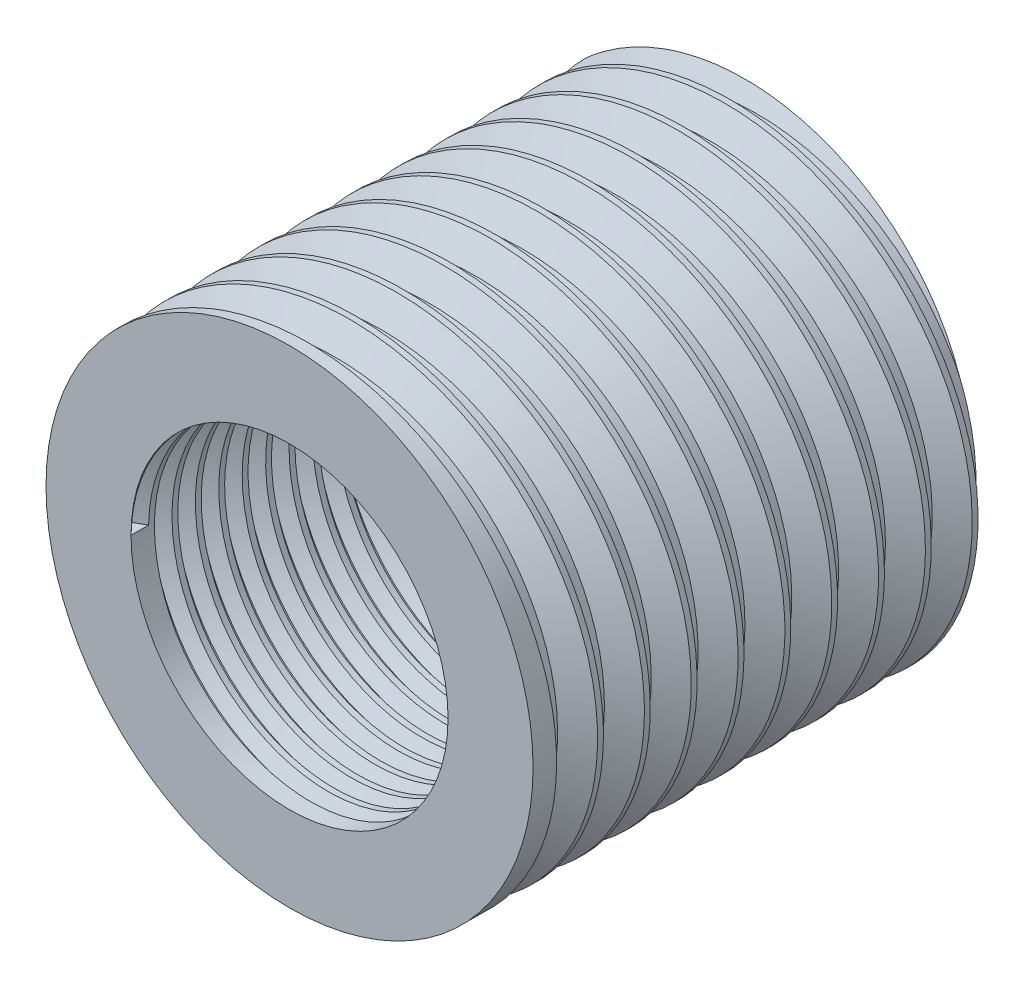
from build123d import *

# Parameters (mm, degrees)
SKETCH1_R           = 10.4
SKETCH1_R_2         = 6.769294136
BOSS_EXTRUDE1_DEPTH = 20
THREAD1_PITCH       = 1
THREAD2_PITCH       = 2


with BuildPart() as part:
    # Sketch1 → Boss-Extrude1 (new body)
    with BuildSketch(Plane.XY):
        Circle(SKETCH1_R)
        Circle(SKETCH1_R_2, mode=Mode.SUBTRACT)
    extrude(amount=BOSS_EXTRUDE1_DEPTH)

    # Thread1: the profile of Thread Profile1 profile screwed along a right-hand helix of 20 turns, 8 arcs to a turn; built about Z, then put on its axis
    thread1_z = Axis((0, 0, 0), (0, 0, 1))
    thread1_corners = [(6.768994136, 0, -0.000173205), (7.310560011, 0, 0.312499999), (7.310560011, 0, 0.437499999), (6.768994136, 0, 0.750173202)]
    with BuildLine(mode=Mode.PRIVATE) as thread1_profile:
        Line(thread1_corners[0], thread1_corners[1])
        Line(thread1_corners[1], thread1_corners[2])
        Line(thread1_corners[2], thread1_corners[3])
        Line(thread1_corners[3], thread1_corners[0])
    thread1_cap = Face(thread1_profile.wire())
    thread1_turn_angles = [0, 22.5, 45, 67.5, 90, 112.5, 135, 157.5, 180, 202.5, 225, 247.5, 270, 292.5, 315, 337.5, 360]
    thread1_turn_weights = [1, 0.9238795325112867, 1, 0.9238795325112867, 1, 0.9238795325112867, 1, 0.9238795325112867, 1, 0.9238795325112867, 1, 0.9238795325112867, 1, 0.9238795325112867, 1, 0.9238795325112867, 1]
    thread1_turn_rails = [Edge.make_bspline([Vector(p[0], p[1], 0).rotate(thread1_z, thread1_turn_angles[k]) / thread1_turn_weights[k] + Vector(0, 0, p[2] + THREAD1_PITCH * thread1_turn_angles[k] / 360) for k in range(17)], [0, 0, 0, 1, 1, 2, 2, 3, 3, 4, 4, 5, 5, 6, 6, 7, 7, 8, 8, 8], 2, thread1_turn_weights) for p in thread1_corners]
    thread1_turn_sides = [Face.make_surface_from_curves(thread1_turn_rails[p[0]], thread1_turn_rails[p[1]]) for p in [(0, 1), (1, 2), (2, 3), (3, 0)]]
    thread1 = Plane(origin=(0, 0, 20), x_dir=(-1, 0, 0), z_dir=(0, 0, -1)) * Solid(Shell([*[p.moved(Location((0, 0, THREAD1_PITCH * i))) for i in range(20) for p in thread1_turn_sides], thread1_cap, thread1_cap.rotate(thread1_z, 7200).moved(Location((0, 0, THREAD1_PITCH * 7200 / 360)))]))
    add(thread1, mode=Mode.SUBTRACT)

    # Thread2: the profile of Thread Profile2 profile screwed along a right-hand helix of 10 turns, 10 arcs to a turn; built about Z, then put on its axis
    thread2_z = Axis((0, 0, 0), (0, 0, 1))
    thread2_corners = [(10.4003, 0, -0.000173205), (10.4003, 0, 1.7501732), (9.31746825, 0, 1.124999997), (9.31746825, 0, 0.624999997)]
    with BuildLine(mode=Mode.PRIVATE) as thread2_profile:
        Line(thread2_corners[0], thread2_corners[1])
        Line(thread2_corners[1], thread2_corners[2])
        Line(thread2_corners[2], thread2_corners[3])
        Line(thread2_corners[3], thread2_corners[0])
    thread2_cap = Face(thread2_profile.wire())
    thread2_turn_angles = [0, 18, 36, 54, 72, 90, 108, 126, 144, 162, 180, 198, 216, 234, 252, 270, 288, 306, 324, 342, 360]
    thread2_turn_weights = [1, 0.9510565162951535, 1, 0.9510565162951535, 1, 0.9510565162951535, 1, 0.9510565162951535, 1, 0.9510565162951535, 1, 0.9510565162951535, 1, 0.9510565162951535, 1, 0.9510565162951535, 1, 0.9510565162951535, 1, 0.9510565162951535, 1]
    thread2_turn_rails = [Edge.make_bspline([Vector(p[0], p[1], 0).rotate(thread2_z, thread2_turn_angles[k]) / thread2_turn_weights[k] + Vector(0, 0, p[2] + THREAD2_PITCH * thread2_turn_angles[k] / 360) for k in range(21)], [0, 0, 0, 1, 1, 2, 2, 3, 3, 4, 4, 5, 5, 6, 6, 7, 7, 8, 8, 9, 9, 10, 10, 10], 2, thread2_turn_weights) for p in thread2_corners]
    thread2_turn_sides = [Face.make_surface_from_curves(thread2_turn_rails[p[0]], thread2_turn_rails[p[1]]) for p in [(0, 1), (1, 2), (2, 3), (3, 0)]]
    thread2 = Plane(origin=(0, 0, 20), x_dir=(-1, 0, 0), z_dir=(0, 0, -1)) * Solid(Shell([*[p.moved(Location((0, 0, THREAD2_PITCH * i))) for i in range(10) for p in thread2_turn_sides], thread2_cap, thread2_cap.rotate(thread2_z, 3600).moved(Location((0, 0, THREAD2_PITCH * 3600 / 360)))]))
    add(thread2, mode=Mode.SUBTRACT)


solid = part.part
